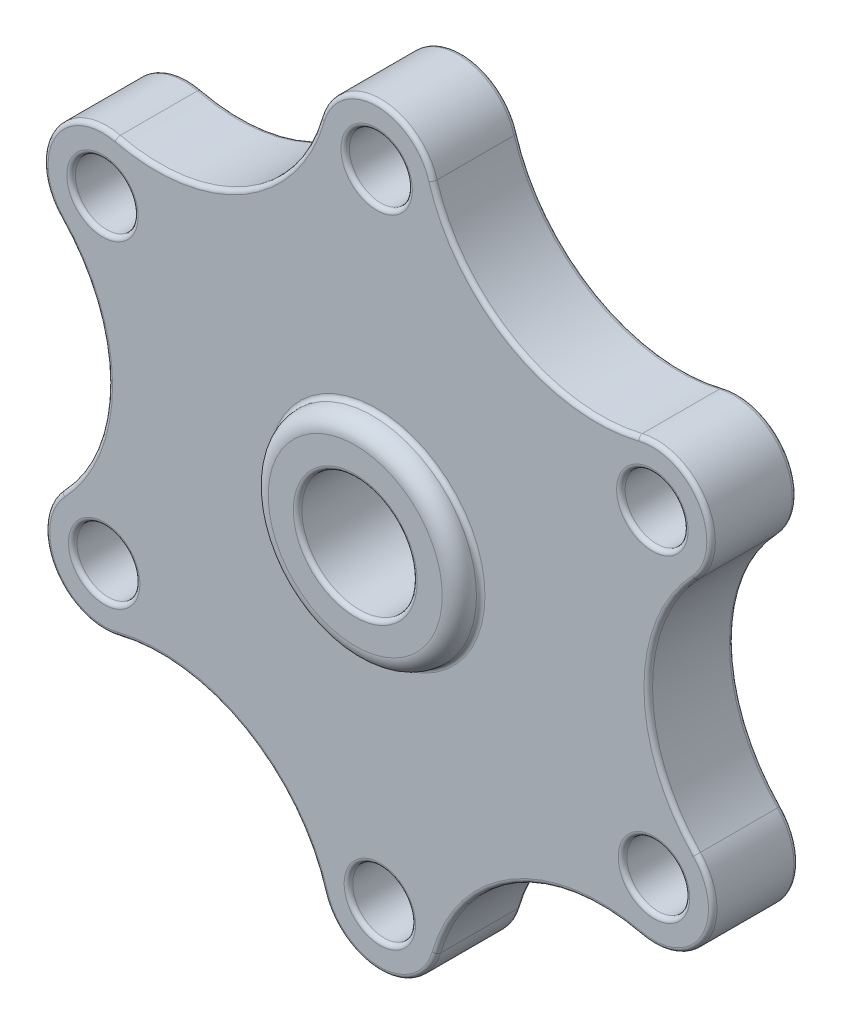
from build123d import *

# Parameters (mm, degrees)
SKETCH1_R           = 12.179565837
SKETCH1_R_2         = 6.746953737
BOSS_EXTRUDE1_DEPTH = 7.5
SKETCH1_3_R         = 3.680156584
SKETCH1_3_R_2       = 12.179565837
BOSS_EXTRUDE2_DEPTH = 5
FILLET1_R           = 2
FILLET2_R           = 2
FILLET3_R           = 0.5


with BuildPart() as part:
    # Sketch1 → Boss-Extrude1 (new, symmetric)
    with BuildSketch(Plane.XY):
        Circle(SKETCH1_R)
        Circle(SKETCH1_R_2, mode=Mode.SUBTRACT)
    extrude(amount=BOSS_EXTRUDE1_DEPTH, both=True)

    # Sketch1<3> → Boss-Extrude2 (add, symmetric)
    with BuildSketch(Plane.XY):
        with BuildLine():
            ThreePointArc((-30.473070588, 24.845067554), (-15.74184606, 27.030197188), (-6.604672262, 38.790121618))
            ThreePointArc((-6.604672262, 38.790121618), (-0.03543434, 43.768076709), (6.584801162, 38.858147417))
            ThreePointArc((6.584801162, 38.858147417), (15.8427912, 27.193097564), (30.595771402, 25.160035151))
            ThreePointArc((30.595771402, 25.160035151), (38.191425931, 21.959885773), (37.249420184, 13.771629003))
            ThreePointArc((37.249420184, 13.771629003), (31.776185694, -0.078550485), (37.391992098, -13.871537328))
            ThreePointArc((37.391992098, -13.871537328), (38.418408705, -22.049641797), (30.856167456, -25.327969275))
            ThreePointArc((30.856167456, -25.327969275), (16.124942928, -27.513098909), (6.98776913, -39.273023339))
            ThreePointArc((6.98776913, -39.273023339), (0.418531208, -44.250978431), (-6.201704295, -39.341049138))
            ThreePointArc((-6.201704295, -39.341049138), (-15.459694333, -27.675999285), (-30.212674534, -25.642936872))
            ThreePointArc((-30.212674534, -25.642936872), (-37.808329063, -22.442787494), (-36.866323316, -14.254530724))
            ThreePointArc((-36.866323316, -14.254530724), (-31.393088826, -0.404351236), (-37.00889523, 13.388635606))
            ThreePointArc((-37.00889523, 13.388635606), (-38.035311838, 21.566740076), (-30.473070588, 24.845067554))
        make_face()
        with Locations((-32.067706649, 18.162257666)):
            Circle(SKETCH1_3_R, mode=Mode.SUBTRACT)
        with Locations((-31.876158216, -18.976931006)):
            Circle(SKETCH1_3_R, mode=Mode.SUBTRACT)
        with Locations((0.383096867, -37.380639533)):
            Circle(SKETCH1_3_R, mode=Mode.SUBTRACT)
        with Locations((32.450803517, -18.645159387)):
            Circle(SKETCH1_3_R, mode=Mode.SUBTRACT)
        with Locations((32.259255083, 18.494029285)):
            Circle(SKETCH1_3_R, mode=Mode.SUBTRACT)
        with Locations((0, 36.897737812)):
            Circle(SKETCH1_3_R, mode=Mode.SUBTRACT)
        Circle(SKETCH1_3_R_2, mode=Mode.SUBTRACT)
    extrude(amount=BOSS_EXTRUDE2_DEPTH, both=True)

    # Fillet1
    fillet1_edges = [part.edges().sort_by_distance(p)[0] for p in [
        (-12.179565837, 0, -7.5),
    ]]
    fillet(fillet1_edges, radius=FILLET1_R)

    # Fillet2
    fillet2_edges = [part.edges().sort_by_distance(p)[0] for p in [
        (-12.179565837, 0, 7.5),
    ]]
    fillet(fillet2_edges, radius=FILLET2_R)

    # Fillet3
    fillet3_edges = [part.edges().sort_by_distance(p)[0] for p in [
        (-38.035311838, 21.566740076, -5),
        (-31.393088826, -0.404351236, 5),
        (-37.808329063, -22.442787494, -5),
        (-15.459694333, -27.675999285, 5),
        (0.418531208, -44.250978431, -5),
        (16.124942928, -27.513098909, 5),
        (38.418408705, -22.049641797, -5),
        (31.776185694, -0.078550485, 5),
        (38.191425931, 21.959885773, -5),
        (15.8427912, 27.193097564, 5),
        (-3.680156584, 36.897737812, 5),
        (28.579098499, 18.494029285, 5),
        (28.770646933, -18.645159387, 5),
        (-3.297059716, -37.380639533, 5),
        (-35.556314799, -18.976931006, 5),
        (-35.747863233, 18.162257666, 5),
        (-0.03543434, 43.768076709, -5),
        (-12.179565837, 0, 5),
        (-38.035311838, 21.566740076, 5),
        (-37.808329063, -22.442787494, 5),
        (0.418531208, -44.250978431, 5),
        (38.418408705, -22.049641797, 5),
        (38.191425931, 21.959885773, 5),
        (-0.03543434, 43.768076709, 5),
        (-15.74184606, 27.030197188, -5),
        (15.8427912, 27.193097564, -5),
        (31.776185694, -0.078550485, -5),
        (16.124942928, -27.513098909, -5),
        (-15.459694333, -27.675999285, -5),
        (-31.393088826, -0.404351236, -5),
        (-35.747863233, 18.162257666, -5),
        (-35.556314799, -18.976931006, -5),
        (-3.297059716, -37.380639533, -5),
        (28.770646933, -18.645159387, -5),
        (28.579098499, 18.494029285, -5),
        (-3.680156584, 36.897737812, -5),
        (-6.746953737, 0, -7.5),
        (-6.746953737, 0, 7.5),
        (-12.179565837, 0, -5),
        (-15.74184606, 27.030197188, 5),
    ]]
    fillet(fillet3_edges, radius=FILLET3_R - 0.0001)  # a hair under: the kernel refuses the full size


solid = part.part
